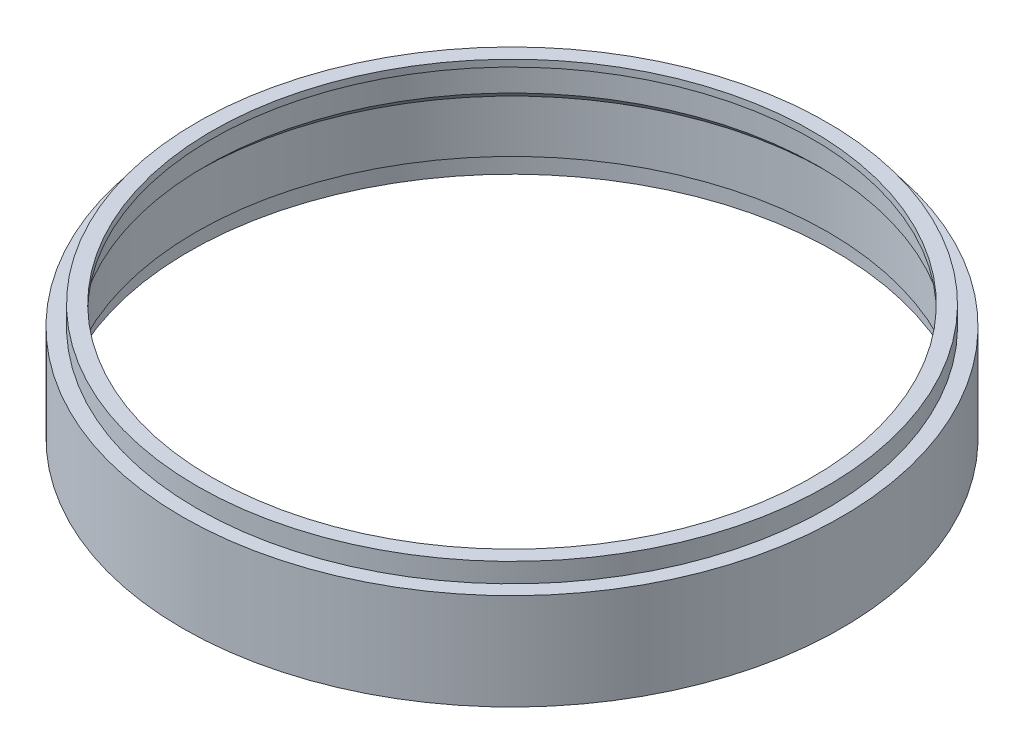
from build123d import *


with BuildPart() as part:
    # Sketch1 → Revolve1 (revolve)
    with BuildSketch(Plane.XY):
        Polygon((-48.35, 0), (-48.35, 14.15), (-46.219999369, 14.15), (-46.219999369, 17), (-44.019999369, 17), (-44.019999369, 16), (-45.019999369, 16), (-45.019999369, 12), (-46.35, 10.669999369), (-46.35, 3), (-47.4, 3), (-47.4, 0), align=None)
    revolve(axis=Axis((0, 0, 0), (0, -1, 0)))


solid = part.part
